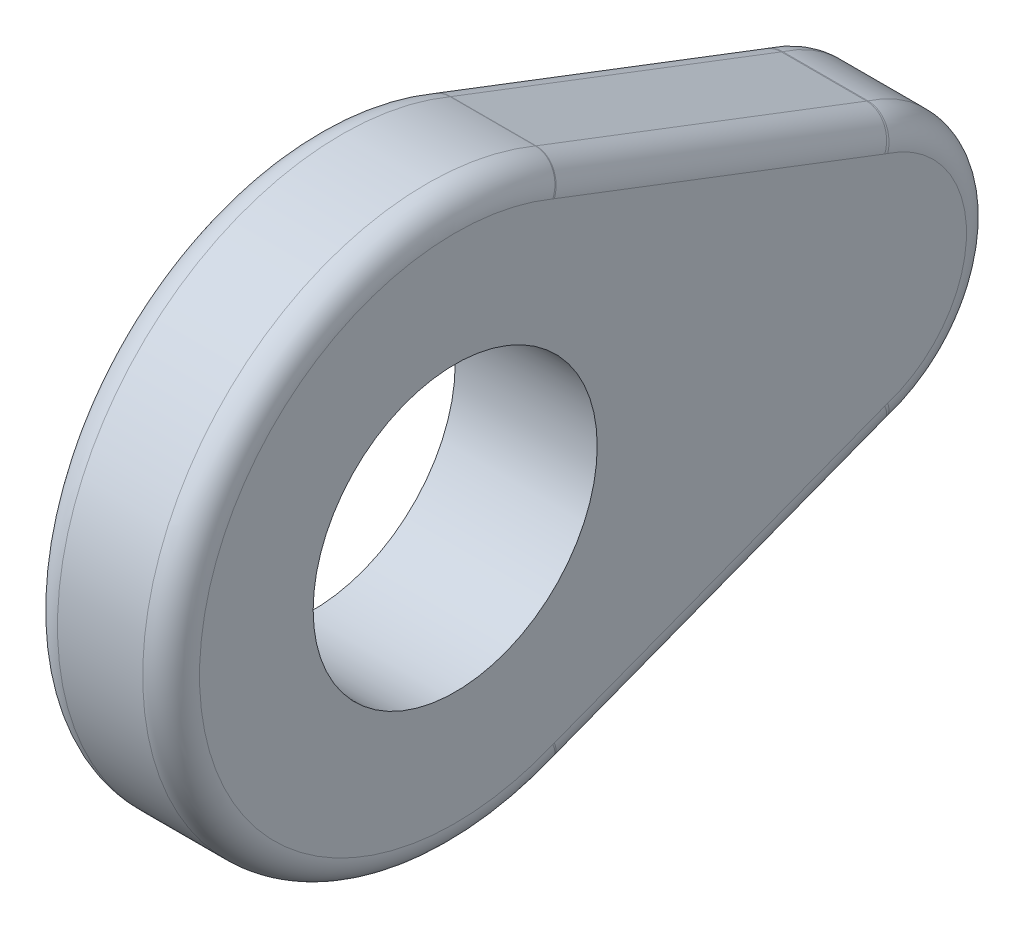
from build123d import *

# Parameters (mm, degrees)
SKETCH1_R           = 5
BOSS_EXTRUDE1_DEPTH = 5
FILLET2_R           = 1


with BuildPart() as part:
    # Sketch1 → Boss-Extrude1 (new body)
    with BuildSketch(Plane(origin=(0, 0, 0), x_dir=(0, 0, -1), z_dir=(1, 0, 0))):
        with BuildLine():
            Line((3.834545484, -9.235597487), (15.508521108, -4.767007874))
            ThreePointArc((15.508521108, -4.767007874), (19, 0), (15.508521108, 4.767007874))
            Line((15.508521108, 4.767007874), (3.834545484, 9.235597487))
            ThreePointArc((3.834545484, 9.235597487), (-10, 0), (3.834545484, -9.235597487))
        make_face()
        Circle(SKETCH1_R, mode=Mode.SUBTRACT)
    extrude(amount=BOSS_EXTRUDE1_DEPTH)

    # Fillet2
    # the kernel refuses this fillet: 1 mm, written as the material it adds along each edge
    with BuildSketch(Plane(origin=(0, -9.235597487, -3.834545484), x_dir=(0, -0.3828536121528857, 0.9238090233708955), z_dir=(1, 0, 0))) as fillet2_piece_1:
        with BuildLine():
            CenterArc((0.013662307, 0.999999788), FILLET2_R, 268.43540008, 1.527324084)
            Line((-0.01364172, 0.000372613), (0, 0))
            ThreePointArc((0, 0), (0.00650586, 2.116e-06), (0.013011721, 0))
        make_face()
    extrude(amount=5)
    with BuildSketch(Plane(origin=(0, 9.235597487, -3.834545484), x_dir=(0, -0.35748716903167743, -0.9339180499260719), z_dir=(1, 0, 0))) as fillet2_piece_2:
        with BuildLine():
            CenterArc((0.013646808, 1), FILLET2_R, 268.472675916, 1.527324084)
            ThreePointArc((-0.013006869, 0.000355272), (-0.006503377, 0.000179752), (0, 0))
            Line((0, 0), (0.013646808, 0))
        make_face()
    extrude(amount=5)
    with BuildSketch(Plane(origin=(0, 4.767007874, -15.508521108), x_dir=(0, 0.3574871690316874, 0.9339180499260681), z_dir=(1, 0, 0))) as fillet2_piece_3:
        with BuildLine():
            CenterArc((0.028209357, -1), FILLET2_R, 90, 3.090872231)
            ThreePointArc((-0.025710379, -0.001454727), (-0.012854253, -0.000743916), (0, 0))
            Line((0, 0), (0.028209357, 0))
        make_face()
    extrude(amount=5)
    with BuildSketch(Plane(origin=(0, -4.767007874, -15.508521108), x_dir=(0, -0.3574871690316535, 0.933918049926081), z_dir=(1, 0, 0))) as fillet2_piece_4:
        with BuildLine():
            CenterArc((0.028209357, 1), FILLET2_R, 266.909127769, 3.090872231)
            ThreePointArc((-0.025710379, 0.001454727), (-0.012854253, 0.000743916), (0, 0))
            Line((0, 0), (0.028209357, 0))
        make_face()
    extrude(amount=5)
    # the kernel refuses this fillet: 1 mm, written as the material it takes off along each edge
    with BuildSketch(Plane(origin=(5, 0, -14), x_dir=(0, -0.9518350677637516, -0.3066105082595415), z_dir=(0, -0.3066105082595415, 0.9518350677637516))) as fillet2_2_piece_1:
        with BuildLine():
            CenterArc((5 - FILLET2_R, -FILLET2_R), FILLET2_R, 0, 90)
            Line((5, -FILLET2_R), (5, 0))
            Line((5, 0), (5 - FILLET2_R, 0))
        make_face()
    revolve(axis=Axis((5, 0, -14), (1, 0, 0)), revolution_arc=144.289835586, mode=Mode.SUBTRACT)
    with BuildSketch(Plane(origin=(5, 4.777092357, -15.482175881), x_dir=(-1, 0, 0), z_dir=(0, 0.3574871690316615, 0.933918049926078)), Plane(origin=(0, -9.230718928, -3.847290484), x_dir=(0, 0.9339180499260781, 0.35748716903166156), z_dir=(0, 0.3574871690316615, -0.933918049926078))) as fillet2_2_piece_2:
        with BuildLine():
            CenterArc((FILLET2_R, FILLET2_R), FILLET2_R, 180, 90)
            Line((0, FILLET2_R), (0, 0))
            Line((0, 0), (FILLET2_R, 0))
        make_face()
    extrude(amount=12.458143836, mode=Mode.SUBTRACT)
    with BuildSketch(Plane(origin=(5, 0, 0), x_dir=(0, 0.9240579070749063, -0.38225251388623166), z_dir=(0, -0.38225251388623166, -0.9240579070749063))) as fillet2_2_piece_3:
        with BuildLine():
            CenterArc((10 - FILLET2_R, -FILLET2_R), FILLET2_R, 0, 90)
            Line((10, -FILLET2_R), (10, 0))
            Line((10, 0), (10 - FILLET2_R, 0))
        make_face()
    revolve(axis=Axis((5, 0, 0), (1, 0, 0)), revolution_arc=224.946557044, mode=Mode.SUBTRACT)
    with BuildSketch(Plane(origin=(5, -9.230718928, -3.847290484), x_dir=(0, 0.9339180499260781, 0.35748716903166156), z_dir=(0, 0.3574871690316615, -0.933918049926078)), Plane(origin=(0, 4.777092357, -15.482175881), x_dir=(1, 0, 0), z_dir=(0, 0.3574871690316615, 0.933918049926078))) as fillet2_2_piece_4:
        with BuildLine():
            CenterArc((FILLET2_R, -FILLET2_R), FILLET2_R, 90, 90)
            Line((0, -FILLET2_R), (0, 0))
            Line((0, 0), (FILLET2_R, 0))
        make_face()
    extrude(amount=12.458143836, mode=Mode.SUBTRACT)
    with BuildSketch(Plane(origin=(0, 0, 0), x_dir=(0, 0.9240579070749063, -0.38225251388623166), z_dir=(0, -0.38225251388623166, -0.9240579070749063))) as fillet2_2_piece_5:
        with BuildLine():
            CenterArc((10 - FILLET2_R, FILLET2_R), FILLET2_R, 270, 90)
            Line((10, FILLET2_R), (10, 0))
            Line((10, 0), (10 - FILLET2_R, 0))
        make_face()
    revolve(axis=Axis((0, 0, 0), (1, 0, 0)), revolution_arc=224.946557044, mode=Mode.SUBTRACT)
    with BuildSketch(Plane(origin=(0, 0, -14), x_dir=(0, -0.9518350677637516, -0.3066105082595415), z_dir=(0, -0.3066105082595415, 0.9518350677637516))) as fillet2_2_piece_6:
        with BuildLine():
            CenterArc((5 - FILLET2_R, FILLET2_R), FILLET2_R, 270, 90)
            Line((5, FILLET2_R), (5, 0))
            Line((5, 0), (5 - FILLET2_R, 0))
        make_face()
    revolve(axis=Axis((0, 0, -14), (1, 0, 0)), revolution_arc=144.289835586, mode=Mode.SUBTRACT)
    with BuildSketch(Plane(origin=(0, -10.164636978, -4.204777653), x_dir=(0, 0.9240579070749084, 0.38225251388622655), z_dir=(0, -0.38225251388622655, 0.9240579070749084))) as fillet2_2_piece_7:
        with BuildLine():
            CenterArc((1 + FILLET2_R, -FILLET2_R), FILLET2_R, 90, 90)
            Line((1, -FILLET2_R), (1, 0))
            Line((1, 0), (1 + FILLET2_R, 0))
        make_face()
    revolve(axis=Axis((0, -10.164636978, -4.204777653), (-1, 0, 0)), revolution_arc=1.527324084, mode=Mode.SUBTRACT)
    with BuildSketch(Plane(origin=(0, -5.711010407, -15.83966305), x_dir=(0, 0.9339180499260777, 0.35748716903166233), z_dir=(0, -0.35748716903166233, 0.9339180499260777))) as fillet2_2_piece_8:
        with BuildLine():
            CenterArc((1 + FILLET2_R, -FILLET2_R), FILLET2_R, 90, 90)
            Line((1, -FILLET2_R), (1, 0))
            Line((1, 0), (1 + FILLET2_R, 0))
        make_face()
    revolve(axis=Axis((0, -5.711010407, -15.83966305), (-1, 0, 0)), revolution_arc=3.090872231, mode=Mode.SUBTRACT)
    with BuildSketch(Plane(origin=(0, 5.711010407, -15.83966305), x_dir=(0, -0.9339180499260777, 0.35748716903166233), z_dir=(0, 0.35748716903166233, 0.9339180499260777))) as fillet2_2_piece_9:
        with BuildLine():
            CenterArc((1 + FILLET2_R, FILLET2_R), FILLET2_R, 180, 90)
            Line((1, FILLET2_R), (1, 0))
            Line((1, 0), (1 + FILLET2_R, 0))
        make_face()
    revolve(axis=Axis((0, 5.711010407, -15.83966305), (1, 0, 0)), revolution_arc=3.090872231, mode=Mode.SUBTRACT)
    with BuildSketch(Plane(origin=(0, 10.164636978, -4.204777653), x_dir=(0, -0.9339180499260781, 0.35748716903166156), z_dir=(0, -0.35748716903166156, -0.9339180499260781))) as fillet2_2_piece_10:
        with BuildLine():
            CenterArc((1 + FILLET2_R, -FILLET2_R), FILLET2_R, 90, 90)
            Line((1, -FILLET2_R), (1, 0))
            Line((1, 0), (1 + FILLET2_R, 0))
        make_face()
    revolve(axis=Axis((0, 10.164636978, -4.204777653), (-1, 0, 0)), revolution_arc=1.527324084, mode=Mode.SUBTRACT)
    with BuildSketch(Plane(origin=(5, -10.164636978, -4.204777653), x_dir=(0, 0.9240579070749084, 0.38225251388622655), z_dir=(0, -0.38225251388622655, 0.9240579070749084))) as fillet2_2_piece_11:
        with BuildLine():
            CenterArc((1 + FILLET2_R, FILLET2_R), FILLET2_R, 180, 90)
            Line((1, FILLET2_R), (1, 0))
            Line((1, 0), (1 + FILLET2_R, 0))
        make_face()
    revolve(axis=Axis((5, -10.164636978, -4.204777653), (-1, 0, 0)), revolution_arc=1.527324084, mode=Mode.SUBTRACT)
    with BuildSketch(Plane(origin=(5, -5.711010407, -15.83966305), x_dir=(0, 0.9339180499260777, 0.35748716903166233), z_dir=(0, -0.35748716903166233, 0.9339180499260777))) as fillet2_2_piece_12:
        with BuildLine():
            CenterArc((1 + FILLET2_R, FILLET2_R), FILLET2_R, 180, 90)
            Line((1, FILLET2_R), (1, 0))
            Line((1, 0), (1 + FILLET2_R, 0))
        make_face()
    revolve(axis=Axis((5, -5.711010407, -15.83966305), (-1, 0, 0)), revolution_arc=3.090872231, mode=Mode.SUBTRACT)
    with BuildSketch(Plane(origin=(5, 10.164636978, -4.204777653), x_dir=(0, -0.9339180499260781, 0.35748716903166156), z_dir=(0, -0.35748716903166156, -0.9339180499260781))) as fillet2_2_piece_13:
        with BuildLine():
            CenterArc((1 + FILLET2_R, FILLET2_R), FILLET2_R, 180, 90)
            Line((1 + FILLET2_R, 0), (1, 0))
            Line((1, 0), (1, FILLET2_R))
        make_face()
    revolve(axis=Axis((5, 10.164636978, -4.204777653), (-1, 0, 0)), revolution_arc=1.527324084, mode=Mode.SUBTRACT)
    with BuildSketch(Plane(origin=(5, 5.711010407, -15.83966305), x_dir=(0, -0.9339180499260777, 0.35748716903166233), z_dir=(0, 0.35748716903166233, 0.9339180499260777))) as fillet2_2_piece_14:
        with BuildLine():
            CenterArc((1 + FILLET2_R, -FILLET2_R), FILLET2_R, 90, 90)
            Line((1, -FILLET2_R), (1, 0))
            Line((1, 0), (1 + FILLET2_R, 0))
        make_face()
    revolve(axis=Axis((5, 5.711010407, -15.83966305), (1, 0, 0)), revolution_arc=3.090872231, mode=Mode.SUBTRACT)


solid = part.part
